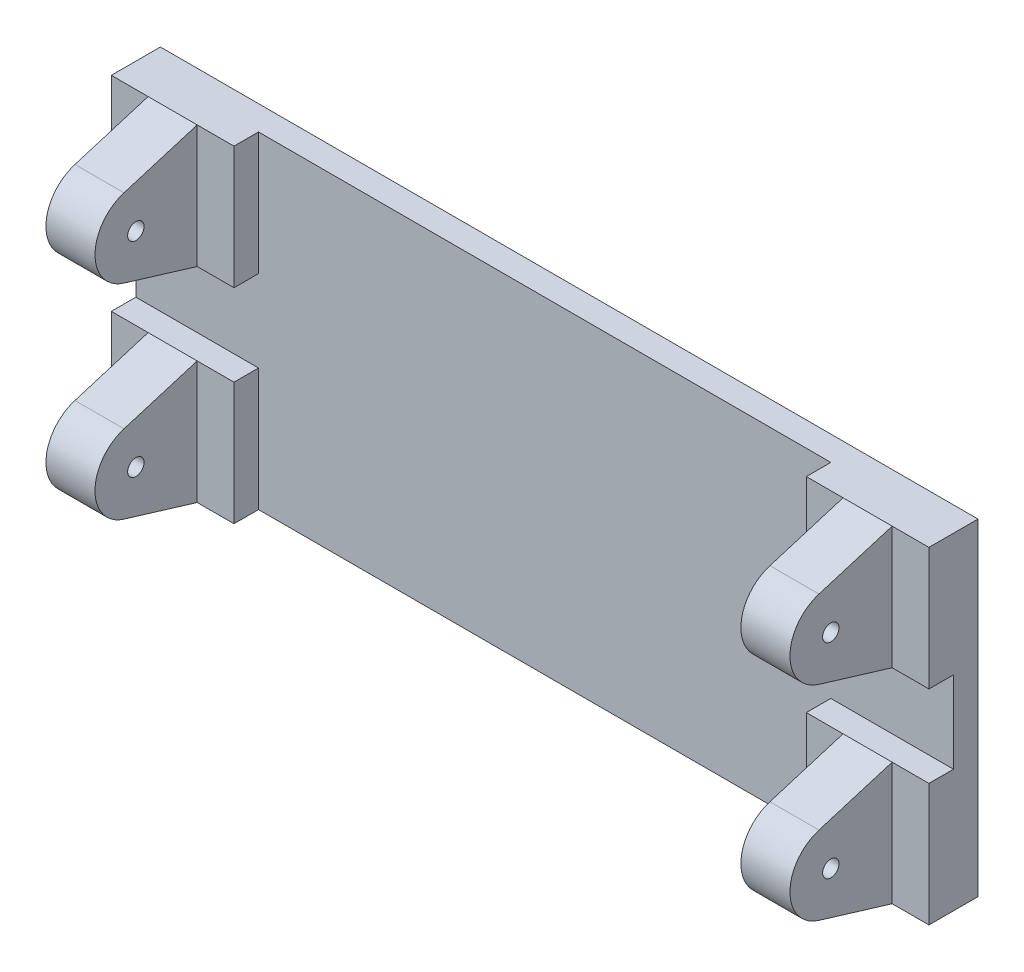
from build123d import *

# Parameters (mm, degrees)
SKETCH1_W               = 100
SKETCH1_H               = 40
BOSS_EXTRUDE1_DEPTH     = 3
SKETCH2_W               = 15
SKETCH2_H               = 15
BOSS_EXTRUDE2_DEPTH     = 3
SKETCH3_R               = 1
BOSS_EXTRUDE3_DEPTH     = 15
CUT_EXTRUDE1_REACH      = 68.65
SKETCH4_W               = 4.5
SKETCH4_H               = 12.5
MIRROR2_COPY_1_SKETCH_R = 1
MIRROR2_COPY_1_DEPTH    = 15
MIRROR2_COPY_2_REACH    = 68.65
MIRROR2_COPY_2_SKETCH_W = 4.5
MIRROR2_COPY_2_SKETCH_H = 12.5
MIRROR2_COPY_3_SKETCH_R = 1
MIRROR2_COPY_3_DEPTH    = 15
MIRROR2_COPY_4_REACH    = 68.65
MIRROR2_COPY_4_SKETCH_W = 4.5
MIRROR2_COPY_4_SKETCH_H = 12.5


with BuildPart() as part:
    # Sketch1 → Boss-Extrude1 (new body)
    with BuildSketch(Plane.XY):
        Rectangle(SKETCH1_W, SKETCH1_H)
    extrude(amount=BOSS_EXTRUDE1_DEPTH)

    # Sketch2 → Boss-Extrude2 (add)
    with BuildSketch(Plane.XY.offset(3)):
        with Locations((-42.5, 12.5)):
            Rectangle(SKETCH2_W, SKETCH2_H)
        with Locations((-42.5, -12.5)):
            Rectangle(SKETCH2_W, SKETCH2_H)
        with Locations((42.5, -12.5)):
            Rectangle(SKETCH2_W, SKETCH2_H)
        with Locations((42.5, 12.5)):
            Rectangle(SKETCH2_W, SKETCH2_H)
    extrude(amount=BOSS_EXTRUDE2_DEPTH)

    # Sketch3 → Boss-Extrude3 (add)
    with BuildSketch(Plane.ZY.offset(50)):
        with BuildLine():
            Line((6, 5), (14.951381156, 7.715285511))
            ThreePointArc((14.951381156, 7.715285511), (18.5, 12.5), (14.951381156, 17.284714489))
            Line((14.951381156, 17.284714489), (6, 20))
            Line((6, 20), (6, 5))
        make_face()
        with Locations((13.5, 12.5)):
            Circle(SKETCH3_R, mode=Mode.SUBTRACT)
    boss_extrude3 = extrude(amount=-BOSS_EXTRUDE3_DEPTH)

    # Sketch4 → Cut-Extrude1 (cut, up to next)
    with BuildSketch(Plane(origin=(0, 20, 0), x_dir=(1, 0, 0), z_dir=(0, 1, 0)), mode=Mode.PRIVATE) as cut_extrude1_sk1:
        with Locations((-37.25, -12.25)):
            Rectangle(SKETCH4_W, SKETCH4_H)
    cut_extrude1_tool1 = extrude(cut_extrude1_sk1.sketch, amount=-CUT_EXTRUDE1_REACH, mode=Mode.PRIVATE) & part.part
    # Sketch4 → Cut-Extrude1 (cut, up to next)
    with BuildSketch(Plane(origin=(0, 20, 0), x_dir=(1, 0, 0), z_dir=(0, 1, 0)), mode=Mode.PRIVATE) as cut_extrude1_sk2:
        with Locations((-47.75, -12.25)):
            Rectangle(SKETCH4_W, SKETCH4_H)
    cut_extrude1_tool2 = extrude(cut_extrude1_sk2.sketch, amount=-CUT_EXTRUDE1_REACH, mode=Mode.PRIVATE) & part.part
    cut_extrude1_1 = cut_extrude1_tool1.solids().sort_by_distance((-37.25, 20, 12.25))[0]
    add(cut_extrude1_1, mode=Mode.SUBTRACT)
    cut_extrude1_2 = cut_extrude1_tool2.solids().sort_by_distance((-47.75, 20, 12.25))[0]
    add(cut_extrude1_2, mode=Mode.SUBTRACT)
    cut_extrude1 = cut_extrude1_1 + cut_extrude1_2  # Cut-Extrude1 as one shape, for the pattern or mirror that repeats it

    # Mirror1: Boss-Extrude3, Cut-Extrude1 across plane
    add(boss_extrude3.mirror(Plane.ZX))
    add(cut_extrude1.mirror(Plane.ZX), mode=Mode.SUBTRACT)

    # Mirror2 copy 1 sketch → Mirror2 copy 1 (add)
    with BuildSketch(Plane(origin=(50, 0, 0), x_dir=(0, 0, 1), z_dir=(1, 0, 0))):
        with BuildLine():
            Line((6, 5), (14.951381156, 7.715285511))
            ThreePointArc((14.951381156, 7.715285511), (18.5, 12.5), (14.951381156, 17.284714489))
            Line((14.951381156, 17.284714489), (6, 20))
            Line((6, 20), (6, 5))
        make_face()
        with Locations((13.5, 12.5)):
            Circle(MIRROR2_COPY_1_SKETCH_R, mode=Mode.SUBTRACT)
    extrude(amount=-MIRROR2_COPY_1_DEPTH)

    # Mirror2 copy 2 sketch → Mirror2 copy 2 (cut, up to next)
    with BuildSketch(Plane(origin=(0, -20, 0), x_dir=(-1, 0, 0), z_dir=(0, -1, 0)), mode=Mode.PRIVATE) as mirror2_copy_2_sk1:
        with Locations((-37.25, -12.25)):
            Rectangle(MIRROR2_COPY_2_SKETCH_W, MIRROR2_COPY_2_SKETCH_H)
    mirror2_copy_2_tool1 = extrude(mirror2_copy_2_sk1.sketch, amount=-MIRROR2_COPY_2_REACH, mode=Mode.PRIVATE) & part.part
    # Mirror2 copy 2 sketch → Mirror2 copy 2 (cut, up to next)
    with BuildSketch(Plane(origin=(0, -20, 0), x_dir=(-1, 0, 0), z_dir=(0, -1, 0)), mode=Mode.PRIVATE) as mirror2_copy_2_sk2:
        with Locations((-47.75, -12.25)):
            Rectangle(MIRROR2_COPY_2_SKETCH_W, MIRROR2_COPY_2_SKETCH_H)
    mirror2_copy_2_tool2 = extrude(mirror2_copy_2_sk2.sketch, amount=-MIRROR2_COPY_2_REACH, mode=Mode.PRIVATE) & part.part
    add(mirror2_copy_2_tool1.solids().sort_by_distance((37.25, -20, 12.25))[0], mode=Mode.SUBTRACT)
    add(mirror2_copy_2_tool2.solids().sort_by_distance((47.75, -20, 12.25))[0], mode=Mode.SUBTRACT)

    # Mirror2 copy 3 sketch → Mirror2 copy 3 (add)
    with BuildSketch(Plane(origin=(50, 0, 0), x_dir=(0, 0, 1), z_dir=(1, 0, 0))):
        with BuildLine():
            Line((6, -5), (14.951381156, -7.715285511))
            ThreePointArc((14.951381156, -7.715285511), (18.5, -12.5), (14.951381156, -17.284714489))
            Line((14.951381156, -17.284714489), (6, -20))
            Line((6, -20), (6, -5))
        make_face()
        with Locations((13.5, -12.5)):
            Circle(MIRROR2_COPY_3_SKETCH_R, mode=Mode.SUBTRACT)
    extrude(amount=-MIRROR2_COPY_3_DEPTH)

    # Mirror2 copy 4 sketch → Mirror2 copy 4 (cut, up to next)
    with BuildSketch(Plane(origin=(0, 20, 0), x_dir=(-1, 0, 0), z_dir=(0, 1, 0)), mode=Mode.PRIVATE) as mirror2_copy_4_sk1:
        with Locations((-37.25, 12.25)):
            Rectangle(MIRROR2_COPY_4_SKETCH_W, MIRROR2_COPY_4_SKETCH_H)
    mirror2_copy_4_tool1 = extrude(mirror2_copy_4_sk1.sketch, amount=-MIRROR2_COPY_4_REACH, mode=Mode.PRIVATE) & part.part
    # Mirror2 copy 4 sketch → Mirror2 copy 4 (cut, up to next)
    with BuildSketch(Plane(origin=(0, 20, 0), x_dir=(-1, 0, 0), z_dir=(0, 1, 0)), mode=Mode.PRIVATE) as mirror2_copy_4_sk2:
        with Locations((-47.75, 12.25)):
            Rectangle(MIRROR2_COPY_4_SKETCH_W, MIRROR2_COPY_4_SKETCH_H)
    mirror2_copy_4_tool2 = extrude(mirror2_copy_4_sk2.sketch, amount=-MIRROR2_COPY_4_REACH, mode=Mode.PRIVATE) & part.part
    add(mirror2_copy_4_tool1.solids().sort_by_distance((37.25, 20, 12.25))[0], mode=Mode.SUBTRACT)
    add(mirror2_copy_4_tool2.solids().sort_by_distance((47.75, 20, 12.25))[0], mode=Mode.SUBTRACT)


solid = part.part
